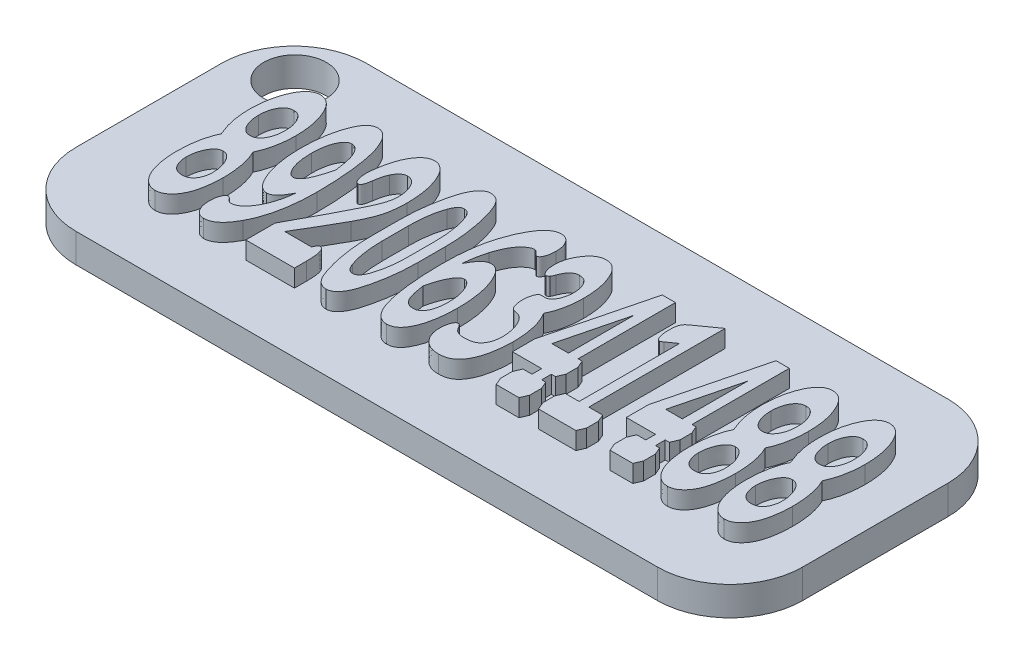
from build123d import *

# Parameters (mm, degrees)
SKETCH_1_W          = 50
SKETCH_1_H          = 20
EXTRUDE_1_DEPTH     = 2
EXTRUDE_448_DEPTH   = 1.2
FILLET_1_R          = 5
FILLET_2_R          = 5
FILLET_3_R          = 5
FILLET_4_R          = 5
SKETCH_4_R          = 2.151855383
CUT_EXTRUDE_1_DEPTH = 3


with BuildPart() as part:
    # Эскиз1 → Бобышка-Вытянуть1 (new body)
    with BuildSketch(Plane(origin=(0, 0, 0), x_dir=(1, 0, 0), z_dir=(0, 1, 0))):
        with Locations((25, 10)):
            Rectangle(SKETCH_1_W, SKETCH_1_H)
    extrude(amount=EXTRUDE_1_DEPTH)

    # Эскиз2 → Extrude 448 (add)
    # profile 1 of 11: a face of its own
    with BuildSketch(Plane(origin=(0, 2, 0), x_dir=(1, 0, 0), z_dir=(0, 1, 0))):
        with BuildLine():
            add(Edge.make_bspline(
                [(7.573556309, 9.600285908), (7.614097975, 9.514557394), (7.696746897, 9.339789807), (7.797801731, 9.062374027), (7.880558655, 8.767248004), (7.951489199, 8.456701902), (8.00595283, 8.129212501), (8.044897616, 7.785319285), (8.06867813, 7.42575086), (8.071567234, 7.180504155), (8.073036116, 7.05581548)],
                knots=[0, 0, 0, 0, 0.869863627, 1.773318598, 2.705048754, 3.681115649, 4.69499462, 5.749702211, 6.855900433, 8, 8, 8, 8], degree=3))
            add(Edge.make_bspline(
                [(8.073036116, 7.05581548), (8.071300059, 6.917145605), (8.067898843, 6.645468945), (8.03317454, 6.246264419), (7.975620786, 5.864714253), (7.898566629, 5.502509161), (7.800399961, 5.166235556), (7.670137386, 4.865473177), (7.520838011, 4.597477557), (7.339918246, 4.372882613), (7.143065075, 4.191376949), (6.932401715, 4.057830032), (6.707417427, 3.977887628), (6.552534727, 3.967409177), (6.47522375, 3.962178772)],
                knots=[0, 0, 0, 0, 1.307194334, 2.561004629, 3.774488178, 4.943198719, 6.050810285, 7.0706307, 8.027859035, 8.934048178, 9.777701725, 10.541735887, 11.272095442, 12, 12, 12, 12], degree=3))
            add(Edge.make_bspline(
                [(6.47522375, 3.962178772), (6.398758529, 3.967377244), (6.245524582, 3.977794821), (6.022692765, 4.058574413), (5.812990911, 4.190715372), (5.618085633, 4.372268194), (5.44331203, 4.599271211), (5.292379621, 4.86580684), (5.163838969, 5.168326766), (5.064629644, 5.505868942), (4.987398844, 5.868910316), (4.934027364, 6.250889169), (4.897970237, 6.648043089), (4.894747173, 6.91800445), (4.89310185, 7.05581548)],
                knots=[0, 0, 0, 0, 0.721796221, 1.446457375, 2.212675403, 3.05265627, 3.951211607, 4.911176021, 5.941488938, 7.052266429, 8.232375546, 9.44812684, 10.697308883, 12, 12, 12, 12], degree=3))
            add(Edge.make_bspline(
                [(4.89310185, 7.05581548), (4.894568323, 7.180504891), (4.897452689, 7.425753043), (4.9212673, 7.78531105), (4.960090766, 8.129241336), (5.014981174, 8.456600333), (5.08446419, 8.767842206), (5.172490412, 9.061301884), (5.268561762, 9.340392082), (5.351724858, 9.514667147), (5.392581656, 9.600285908)],
                knots=[0, 0, 0, 0, 1.144171302, 2.250438881, 3.305212602, 4.319155143, 5.295283236, 6.229301096, 7.130081833, 8, 8, 8, 8], degree=3))
            add(Edge.make_bspline(
                [(5.392581656, 9.600285908), (5.315817568, 9.787048365), (5.160841455, 10.164096025), (5.006931525, 10.766990108), (4.909981225, 11.402377485), (4.898807421, 11.838421115), (4.89310185, 12.061073855)],
                knots=[0, 0, 0, 0, 0.957073933, 1.932200357, 2.944139471, 4, 4, 4, 4], degree=3))
            add(Edge.make_bspline(
                [(4.89310185, 12.061073855), (4.898418341, 12.27754542), (4.908708054, 12.696511582), (4.993522254, 13.301262805), (5.130459125, 13.859724169), (5.292766455, 14.287625184), (5.444959878, 14.59626455), (5.572022432, 14.792435075), (5.701256202, 14.962512673), (5.841669645, 15.100122201), (5.988929324, 15.210766986), (6.147233304, 15.286698295), (6.313045616, 15.333643061), (6.426107165, 15.339862642), (6.483068983, 15.342996144)],
                knots=[0, 0, 0, 0, 1.967284804, 3.807547495, 5.539313067, 7.184775065, 7.957393082, 8.663057112, 9.306676465, 9.895090154, 10.445108397, 10.973224193, 11.482697546, 12, 12, 12, 12], degree=3))
            add(Edge.make_bspline(
                [(6.483068983, 15.342996144), (6.540030622, 15.339862528), (6.653091816, 15.33364272), (6.818906789, 15.286699655), (6.977200186, 15.210761579), (7.124502289, 15.100143922), (7.264739854, 14.962421929), (7.394438864, 14.793194832), (7.518098227, 14.595404626), (7.670991349, 14.28749902), (7.836385865, 13.860286235), (7.972388537, 13.301187823), (8.057492836, 12.696532351), (8.06774106, 12.277552495), (8.073036116, 12.061073855)],
                knots=[0, 0, 0, 0, 0.517362775, 1.026895537, 1.555072916, 2.105155296, 2.693637599, 3.337332004, 4.038837688, 4.811545799, 6.460041003, 8.192008513, 10.032485794, 12, 12, 12, 12], degree=3))
            add(Edge.make_bspline(
                [(8.073036116, 12.061073855), (8.067469393, 11.836644637), (8.056587536, 11.397929314), (7.95824123, 10.760579226), (7.810565083, 10.157347516), (7.651813566, 9.784220506), (7.573556309, 9.600285908)],
                knots=[0, 0, 0, 0, 1.063791813, 2.079505389, 3.053283751, 4, 4, 4, 4], degree=3))
        make_face()
        with BuildLine():
            add(Edge.make_bspline(
                [(7.40357627, 12.000927072), (7.400881187, 12.101399241), (7.3956698, 12.295678693), (7.346723591, 12.574577781), (7.273005759, 12.832078474), (7.163415472, 13.060108044), (7.032907644, 13.254347429), (6.872502773, 13.398604446), (6.686741605, 13.488581823), (6.552877353, 13.497503384), (6.48568406, 13.50198157)],
                knots=[0, 0, 0, 0, 1.239528042, 2.396831194, 3.486589409, 4.536162785, 5.509682768, 6.35620442, 7.174895202, 8, 8, 8, 8], degree=3))
            add(Edge.make_bspline(
                [(6.48568406, 13.50198157), (6.41756145, 13.497655353), (6.282708964, 13.489091368), (6.096066845, 13.397823779), (5.933161756, 13.255405207), (5.802856554, 13.059951899), (5.693093666, 12.832123363), (5.619425513, 12.574564807), (5.570465074, 12.295682293), (5.565255725, 12.101400468), (5.562561695, 12.000927072)],
                knots=[0, 0, 0, 0, 0.833820688, 1.650594315, 2.50321944, 3.474459699, 4.521575254, 5.608781546, 6.763374602, 8, 8, 8, 8], degree=3))
            add(Edge.make_bspline(
                [(5.562561695, 12.000927072), (5.565266502, 11.89959127), (5.570497938, 11.703595072), (5.619342719, 11.422020541), (5.693413454, 11.162223891), (5.80108844, 10.931934152), (5.93514389, 10.738900345), (6.094340772, 10.592500066), (6.283734232, 10.506365477), (6.417745012, 10.495115588), (6.48568406, 10.489412265)],
                knots=[0, 0, 0, 0, 1.241668429, 2.401543046, 3.494043673, 4.546047416, 5.504137523, 6.359918461, 7.168532727, 8, 8, 8, 8], degree=3))
            add(Edge.make_bspline(
                [(6.48568406, 10.489412265), (6.552695802, 10.495261034), (6.685717473, 10.506871134), (6.874233464, 10.591733044), (7.030924822, 10.739942893), (7.165187614, 10.931776637), (7.272684512, 11.162269517), (7.346806805, 11.422007357), (7.395636821, 11.703598728), (7.400870371, 11.899592516), (7.40357627, 12.000927072)],
                knots=[0, 0, 0, 0, 0.822795555, 1.633290479, 2.483061068, 3.443379481, 4.497829953, 5.592871494, 6.755443724, 8, 8, 8, 8], degree=3))
        make_face(mode=Mode.SUBTRACT)
        with BuildLine():
            add(Edge.make_bspline(
                [(7.40357627, 7.032279782), (7.40083224, 7.132728778), (7.395428238, 7.330549733), (7.344625757, 7.619766765), (7.260193419, 7.893490889), (7.148083999, 8.145792408), (7.013914707, 8.362633192), (6.856156217, 8.525506054), (6.676981716, 8.630098946), (6.547067499, 8.642358414), (6.483068983, 8.64839769)],
                knots=[0, 0, 0, 0, 1.189489759, 2.34254209, 3.466495789, 4.576118851, 5.607605723, 6.469471387, 7.246028937, 8, 8, 8, 8], degree=3))
            add(Edge.make_bspline(
                [(6.483068983, 8.64839769), (6.419071355, 8.642357997), (6.289158942, 8.630097682), (6.109970089, 8.525511526), (5.952276444, 8.362608226), (5.817382195, 8.145228937), (5.706032156, 7.890764764), (5.62148475, 7.614512598), (5.570417776, 7.320959943), (5.565221953, 7.119656519), (5.562561695, 7.016589317)],
                knots=[0, 0, 0, 0, 0.748318014, 1.519053169, 2.374456823, 3.398209916, 4.508873786, 5.634203001, 6.788713712, 8, 8, 8, 8], degree=3))
            add(Edge.make_bspline(
                [(5.562561695, 7.016589317), (5.564519013, 6.937906225), (5.568358614, 6.783556341), (5.614649943, 6.561063276), (5.686188734, 6.353459053), (5.781401031, 6.163023537), (5.912177847, 6.003496362), (6.075347034, 5.885390745), (6.270349502, 5.815595323), (6.410142975, 5.807445081), (6.483068983, 5.803193347)],
                knots=[0, 0, 0, 0, 1.103259055, 2.164224919, 3.174489227, 4.181783474, 5.137723691, 6.0412155, 6.978161634, 8, 8, 8, 8], degree=3))
            add(Edge.make_bspline(
                [(6.483068983, 5.803193347), (6.556895147, 5.807344341), (6.697617482, 5.81525668), (6.893245968, 5.885521907), (7.056713141, 6.002687874), (7.184294754, 6.164041181), (7.28132663, 6.35464223), (7.350843043, 6.565721818), (7.39824932, 6.79308981), (7.401765162, 6.950957658), (7.40357627, 7.032279782)],
                knots=[0, 0, 0, 0, 1.024249911, 1.952354446, 2.84732035, 3.786524278, 4.784313077, 5.807988776, 6.870833993, 8, 8, 8, 8], degree=3))
        make_face(mode=Mode.SUBTRACT)
    # profile 2 of 11: a face of its own
    with BuildSketch(Plane(origin=(0, 2, 0), x_dir=(1, 0, 0), z_dir=(0, 1, 0))):
        with BuildLine():
            add(Edge.make_bspline(
                [(11.487281327, 8.64839769), (11.443120138, 8.563194295), (11.360211839, 8.403233281), (11.227347166, 8.189670085), (11.101271099, 8.014308364), (10.981695952, 7.875258561), (10.860868515, 7.771543805), (10.73789485, 7.699387944), (10.611308828, 7.650740653), (10.523600736, 7.646361206), (10.480476482, 7.644207922)],
                knots=[0, 0, 0, 0, 1.544491333, 2.899630935, 4.044871523, 5.019150062, 5.845686048, 6.594201469, 7.308797954, 8, 8, 8, 8], degree=3))
            add(Edge.make_bspline(
                [(10.480476482, 7.644207922), (10.430290606, 7.647817631), (10.329782088, 7.655046887), (10.183984439, 7.712466058), (10.043153577, 7.800943198), (9.907418997, 7.92533019), (9.779803639, 8.086066605), (9.65342786, 8.277990517), (9.534963838, 8.506651707), (9.42092589, 8.765889021), (9.31824374, 9.051066319), (9.226522564, 9.355676466), (9.147531027, 9.677551496), (9.086438701, 10.01754375), (9.035758997, 10.373307064), (9.003124173, 10.746078019), (8.981616037, 11.135084147), (8.978430245, 11.400300708), (8.976806907, 11.535443274)],
                knots=[0, 0, 0, 0, 0.540116355, 1.081704643, 1.668900416, 2.328128021, 3.056702268, 3.878395356, 4.803970782, 5.831493441, 6.932328587, 8.071895476, 9.262630745, 10.505951035, 11.797462611, 13.138567462, 14.541941224, 16, 16, 16, 16], degree=3))
            add(Edge.make_bspline(
                [(8.976806907, 11.535443274), (8.979878585, 11.746549179), (8.985894355, 12.159992454), (9.045914146, 12.764320197), (9.136496445, 13.340136315), (9.231105871, 13.708310595), (9.277540822, 13.889013043)],
                knots=[0, 0, 0, 0, 1.064168464, 2.084135415, 3.059680597, 4, 4, 4, 4], degree=3))
            add(Edge.make_bspline(
                [(9.277540822, 13.889013043), (9.312722205, 14.002800007), (9.379225867, 14.217892454), (9.495353429, 14.516034372), (9.625556706, 14.767410328), (9.763771865, 14.976387376), (9.915484797, 15.139702578), (10.080541985, 15.254844306), (10.256576245, 15.329464525), (10.3795264, 15.338473449), (10.441250319, 15.342996144)],
                knots=[0, 0, 0, 0, 1.436180298, 2.714823602, 3.852703128, 4.844061658, 5.728925662, 6.522115595, 7.258066685, 8, 8, 8, 8], degree=3))
            add(Edge.make_bspline(
                [(10.441250319, 15.342996144), (10.48499613, 15.339980522), (10.572875844, 15.333922523), (10.703346169, 15.300039727), (10.826729708, 15.236568608), (10.949335325, 15.155760012), (11.063874085, 15.046298247), (11.173728678, 14.913745616), (11.28098276, 14.759182636), (11.382705398, 14.580405977), (11.477619014, 14.379480761), (11.571081288, 14.158754904), (11.651873381, 13.915640274), (11.733225342, 13.653416946), (11.797527188, 13.367406965), (11.864523737, 13.062959851), (11.921962435, 12.736666198), (11.986351341, 12.271998383), (12.057994352, 11.670208848), (12.112579501, 10.931994349), (12.152408758, 10.178655307), (12.155287663, 9.670948051), (12.156741173, 9.414615404)],
                knots=[0, 0, 0, 0, 0.402210474, 0.807989175, 1.226820742, 1.670824282, 2.152214144, 2.674888608, 3.249973138, 3.877429647, 4.56122259, 5.289612762, 6.07684574, 6.9125179, 7.809462526, 8.76710454, 9.775136441, 10.85051479, 13.074497134, 15.338564747, 17.646521651, 20, 20, 20, 20], degree=3))
            add(Edge.make_bspline(
                [(12.156741173, 9.414615404), (12.154611607, 9.200102556), (12.15046068, 8.781976483), (12.107252636, 8.171989025), (12.0400466, 7.594116992), (11.946568186, 7.048348086), (11.828035131, 6.533913539), (11.677341373, 6.054064828), (11.505265073, 5.603486626), (11.361652133, 5.323489564), (11.291150513, 5.186035052)],
                knots=[0, 0, 0, 0, 1.180832844, 2.301666342, 3.364825312, 4.382616933, 5.348807173, 6.268666431, 7.150063902, 8, 8, 8, 8], degree=3))
            add(Edge.make_bspline(
                [(11.291150513, 5.186035052), (11.235884251, 5.089309312), (11.130582541, 4.905012684), (10.958139223, 4.654318466), (10.779370561, 4.444113433), (10.599607472, 4.268136364), (10.411664053, 4.132527393), (10.219965318, 4.034140776), (10.023105765, 3.972455853), (9.889884021, 3.965576274), (9.824092024, 3.962178772)],
                knots=[0, 0, 0, 0, 1.334909709, 2.54347351, 3.640443885, 4.638032018, 5.551364312, 6.406426828, 7.213008643, 8, 8, 8, 8], degree=3))
            add(Edge.make_bspline(
                [(9.824092024, 3.962178772), (9.753406595, 3.967465112), (9.615349029, 3.977790002), (9.423069807, 4.06783393), (9.260135852, 4.216415572), (9.18270215, 4.345824267), (9.141556791, 4.414587183)],
                knots=[0, 0, 0, 0, 0.978915843, 1.911946217, 2.890486694, 4, 4, 4, 4], degree=3))
            add(Edge.make_bspline(
                [(9.141556791, 4.414587183), (9.115145115, 4.467877985), (9.060198525, 4.578743643), (9.014743898, 4.768366881), (8.981635621, 4.978252173), (8.978467391, 5.12659397), (8.976806907, 5.204340595)],
                knots=[0, 0, 0, 0, 0.873536651, 1.817297042, 2.856035239, 4, 4, 4, 4], degree=3))
            add(Edge.make_bspline(
                [(8.976806907, 5.204340595), (8.978729981, 5.267999654), (8.982426179, 5.390353994), (8.998760292, 5.565793479), (9.033354377, 5.724389396), (9.079353503, 5.863724378), (9.133354691, 5.981932664), (9.199664895, 6.06619865), (9.269097869, 6.12918679), (9.324484335, 6.135111997), (9.350762992, 6.13792327)],
                knots=[0, 0, 0, 0, 1.419175441, 2.727691474, 3.920195547, 5.025849715, 5.998814525, 6.787596777, 7.424763283, 8, 8, 8, 8], degree=3))
            add(Edge.make_bspline(
                [(9.350762992, 6.13792327), (9.382773052, 6.127965343), (9.463422998, 6.102876158), (9.515491409, 6.035018737), (9.546893807, 5.994094006)],
                knots=[0, 0, 0, 0, 0.793802374, 2, 2, 2, 2], degree=3))
            add(Edge.make_bspline(
                [(9.546893807, 5.994094006), (9.570445248, 5.965433361), (9.614066841, 5.912348585), (9.687655126, 5.848914152), (9.76703836, 5.812349348), (9.821161039, 5.806200307), (9.847627721, 5.803193347)],
                knots=[0, 0, 0, 0, 1.206683572, 2.234999471, 3.136892176, 4, 4, 4, 4], degree=3))
            add(Edge.make_bspline(
                [(9.847627721, 5.803193347), (9.895024222, 5.805572391), (9.989720428, 5.810325621), (10.128519102, 5.853825328), (10.266772506, 5.915780341), (10.398905962, 6.009581437), (10.529753296, 6.126311855), (10.652963112, 6.272450751), (10.780009499, 6.439005536), (10.940586919, 6.702591136), (11.122986817, 7.069602289), (11.295376695, 7.554890094), (11.421772, 8.085457175), (11.464993829, 8.456874799), (11.487281327, 8.64839769)],
                knots=[0, 0, 0, 0, 0.484168293, 0.967347815, 1.478659544, 2.030891222, 2.618845486, 3.27058146, 3.984812665, 4.762718328, 6.427668094, 8.172882214, 10.026532363, 12, 12, 12, 12], degree=3))
        make_face()
        with BuildLine():
            add(Edge.make_bspline(
                [(11.487281327, 11.404689398), (11.47548573, 11.496273531), (11.452760452, 11.672718592), (11.41340804, 11.926438075), (11.372022499, 12.160375645), (11.326387468, 12.37366511), (11.272439781, 12.565796569), (11.220164612, 12.73811608), (11.158413363, 12.888401877), (11.079735552, 13.055990953), (10.970393897, 13.225893267), (10.8255493, 13.381089174), (10.666311975, 13.485428052), (10.549776703, 13.496594222), (10.493551869, 13.50198157)],
                knots=[0, 0, 0, 0, 1.341561386, 2.584638553, 3.72986605, 4.793097259, 5.751690096, 6.62885173, 7.407292807, 8.109698356, 9.318098846, 10.321251498, 11.190053334, 12, 12, 12, 12], degree=3))
            add(Edge.make_bspline(
                [(10.493551869, 13.50198157), (10.435451232, 13.494972666), (10.31510073, 13.480454321), (10.150726883, 13.367165454), (10.007173173, 13.192292277), (9.880718397, 12.957059594), (9.774400208, 12.669553324), (9.701609912, 12.334202888), (9.653881713, 11.956967505), (9.648886848, 11.690769847), (9.646266752, 11.551133739)],
                knots=[0, 0, 0, 0, 0.604297075, 1.251749713, 2.021041256, 2.959625801, 4.029815661, 5.217391592, 6.540360535, 8, 8, 8, 8], degree=3))
            add(Edge.make_bspline(
                [(9.646266752, 11.551133739), (9.648909721, 11.404532897), (9.653959121, 11.124451504), (9.701587485, 10.727252939), (9.774512787, 10.371772355), (9.882102547, 10.06705024), (10.009809031, 9.81850141), (10.146841716, 9.634937696), (10.297793082, 9.510461458), (10.411680806, 9.493248707), (10.464786016, 9.485222497)],
                knots=[0, 0, 0, 0, 1.482531622, 2.83238157, 4.041481393, 5.146072842, 6.092829469, 6.853155664, 7.465232874, 8, 8, 8, 8], degree=3))
            add(Edge.make_bspline(
                [(10.464786016, 9.485222497), (10.5123559, 9.491123235), (10.615011535, 9.503857005), (10.753207026, 9.6101873), (10.88780989, 9.763359278), (11.015431521, 9.978643306), (11.139812025, 10.250918549), (11.2610164, 10.581959775), (11.381437375, 10.971900123), (11.45050874, 11.254328597), (11.487281327, 11.404689398)],
                knots=[0, 0, 0, 0, 0.497696831, 1.074027963, 1.777276761, 2.652500584, 3.697328195, 4.93381738, 6.367609082, 8, 8, 8, 8], degree=3))
        make_face(mode=Mode.SUBTRACT)
    # profile 3 of 11: a face of its own
    with BuildSketch(Plane(origin=(0, 2, 0), x_dir=(1, 0, 0), z_dir=(0, 1, 0))):
        with BuildLine():
            Line((13.395241887, 5.970558308), (15.236256462, 5.970558308))
            add(Edge.make_bspline(
                [(15.236256462, 5.970558308), (15.256515809, 6.020365842), (15.292357716, 6.108483042), (15.357985167, 6.211420135), (15.416245749, 6.287769686), (15.466187484, 6.300082229), (15.487303904, 6.305288231)],
                knots=[0, 0, 0, 0, 1.476957829, 2.612965951, 3.413532736, 4, 4, 4, 4], degree=3))
            add(Edge.make_bspline(
                [(15.487303904, 6.305288231), (15.518828242, 6.301902429), (15.583925969, 6.29491075), (15.668282977, 6.227348066), (15.742609241, 6.130570934), (15.800823411, 5.990750979), (15.851281352, 5.80865021), (15.880979504, 5.574693963), (15.901814361, 5.288420588), (15.904342621, 5.079747466), (15.905716307, 4.96636854)],
                knots=[0, 0, 0, 0, 0.49648233, 1.025235526, 1.659617377, 2.437817421, 3.419908268, 4.671012068, 6.191252082, 8, 8, 8, 8], degree=3))
            Line((15.905716307, 4.96636854), (15.905716307, 4.129543734))
            Line((15.905716307, 4.129543734), (12.55841708, 4.129543734))
            Line((12.55841708, 4.129543734), (12.55841708, 6.13792327))
            add(Edge.make_bspline(
                [(12.55841708, 6.13792327), (12.641397942, 6.289505408), (12.80341799, 6.585469376), (13.037886444, 7.020527309), (13.264145856, 7.432033631), (13.472134694, 7.825888853), (13.671585993, 8.1963858), (13.857265847, 8.546809745), (14.029897402, 8.877616955), (14.192103673, 9.186138894), (14.337684754, 9.476000761), (14.475904435, 9.741625587), (14.594729515, 9.990791725), (14.703631995, 10.217870427), (14.805535581, 10.421570363), (14.88824077, 10.607296972), (14.958900225, 10.772409732), (15.00184386, 10.875541131), (15.021820105, 10.923515134)],
                knots=[0, 0, 0, 0, 1.540533833, 3.007890707, 4.405782956, 5.726830237, 6.978398166, 8.156831539, 9.262153626, 10.304869543, 11.264060161, 12.153748005, 12.973970219, 13.724693827, 14.398925648, 15.004106032, 15.536736427, 16, 16, 16, 16], degree=3))
            add(Edge.make_bspline(
                [(15.021820105, 10.923515134), (15.054725346, 11.012803483), (15.118791104, 11.186645874), (15.187113675, 11.449056476), (15.228311427, 11.704973621), (15.233635861, 11.873516607), (15.236256462, 11.956470755)],
                knots=[0, 0, 0, 0, 1.07571973, 2.094401928, 3.062095275, 4, 4, 4, 4], degree=3))
            add(Edge.make_bspline(
                [(15.236256462, 11.956470755), (15.233344945, 12.055160121), (15.227641701, 12.248478463), (15.180130156, 12.52883871), (15.100911714, 12.791628836), (14.993919429, 13.02943843), (14.86577862, 13.236699105), (14.705604701, 13.387708744), (14.522676472, 13.486950637), (14.390150942, 13.496956472), (14.323594407, 13.50198157)],
                knots=[0, 0, 0, 0, 1.201656711, 2.353873494, 3.452380439, 4.536004299, 5.525640415, 6.397189124, 7.195041602, 8, 8, 8, 8], degree=3))
            add(Edge.make_bspline(
                [(14.323594407, 13.50198157), (14.254831396, 13.494914998), (14.115548402, 13.480601296), (13.926348402, 13.3573784), (13.755376411, 13.174753228), (13.672836974, 13.015707477), (13.627983786, 12.929279592)],
                knots=[0, 0, 0, 0, 0.862288605, 1.746609652, 2.775473348, 4, 4, 4, 4], degree=3))
            add(Edge.make_bspline(
                [(13.627983786, 12.929279592), (13.602992354, 12.873141503), (13.548444733, 12.750611543), (13.493761476, 12.53994957), (13.436507375, 12.295491383), (13.409616198, 12.11887216), (13.395241887, 12.02446277)],
                knots=[0, 0, 0, 0, 0.785419257, 1.714297573, 2.77820903, 4, 4, 4, 4], degree=3))
            add(Edge.make_bspline(
                [(13.395241887, 12.02446277), (13.387069001, 11.965968447), (13.372010777, 11.858194933), (13.34336405, 11.70960157), (13.311610243, 11.587103538), (13.271679086, 11.490968288), (13.230276401, 11.417229793), (13.182753184, 11.364769515), (13.127376187, 11.332889361), (13.087894837, 11.328439245), (13.068357197, 11.326237072)],
                knots=[0, 0, 0, 0, 1.718687884, 3.166615548, 4.403826944, 5.393296858, 6.189559062, 6.853582291, 7.432686669, 8, 8, 8, 8], degree=3))
            add(Edge.make_bspline(
                [(13.068357197, 11.326237072), (13.044713676, 11.329293628), (12.99338818, 11.33592882), (12.930412657, 11.398712594), (12.869384978, 11.482858918), (12.801202791, 11.648894906), (12.739845015, 11.898293317), (12.730632698, 12.111137563), (12.725782041, 12.223208662)],
                knots=[0, 0, 0, 0, 0.410077716, 0.890199137, 1.495835442, 2.252637047, 4.026861929, 6, 6, 6, 6], degree=3))
            add(Edge.make_bspline(
                [(12.725782041, 12.223208662), (12.728815601, 12.318313789), (12.735290836, 12.521318865), (12.77422712, 12.840865069), (12.835261829, 13.194319076), (12.918971663, 13.569169767), (13.022294715, 13.943533333), (13.155847877, 14.288980572), (13.312290667, 14.593551393), (13.488026402, 14.856726328), (13.681893014, 15.068162975), (13.885222111, 15.227451668), (14.104068998, 15.32292409), (14.254776852, 15.336383229), (14.328824562, 15.342996144)],
                knots=[0, 0, 0, 0, 0.906154377, 1.934216822, 3.063307913, 4.32257274, 5.592200714, 6.759641067, 7.844211716, 8.848486001, 9.765233724, 10.565799872, 11.295330456, 12, 12, 12, 12], degree=3))
            add(Edge.make_bspline(
                [(14.328824562, 15.342996144), (14.385771424, 15.339953901), (14.499040263, 15.333902796), (14.664553054, 15.285665935), (14.817813019, 15.200380847), (14.967071375, 15.089971532), (15.104667497, 14.943082526), (15.236981767, 14.766816905), (15.354254053, 14.555247478), (15.511374069, 14.23283751), (15.670655024, 13.778714607), (15.809539407, 13.186274379), (15.889240053, 12.53916926), (15.900088879, 12.090057806), (15.905716307, 11.857097809)],
                knots=[0, 0, 0, 0, 0.494761144, 0.984093207, 1.482556146, 2.013120243, 2.59204621, 3.225693145, 3.925144707, 4.691273024, 6.343201327, 8.095260062, 9.974560224, 12, 12, 12, 12], degree=3))
            add(Edge.make_bspline(
                [(15.905716307, 11.857097809), (15.904753709, 11.736733462), (15.902860443, 11.499997211), (15.87176809, 11.151877055), (15.828355736, 10.816505679), (15.765399682, 10.483248666), (15.663545782, 10.133051495), (15.514455541, 9.745534622), (15.314670037, 9.309693271), (15.155872151, 9.007625217), (15.071506578, 8.847143582)],
                knots=[0, 0, 0, 0, 0.912749152, 1.795222735, 2.649062997, 3.477746559, 4.365161243, 5.411535187, 6.624809669, 8, 8, 8, 8], degree=3))
            add(Edge.make_bspline(
                [(15.071506578, 8.847143582), (15.031581512, 8.773825367), (14.94387655, 8.612764363), (14.79702994, 8.352837412), (14.628845761, 8.050926867), (14.426443944, 7.714093246), (14.206982633, 7.333265212), (13.960677941, 6.913219275), (13.684569595, 6.456656537), (13.494411642, 6.137172984), (13.395241887, 5.970558308)],
                knots=[0, 0, 0, 0, 0.601747611, 1.321882616, 2.151886391, 3.092629613, 4.154122148, 5.320095706, 6.602396334, 8, 8, 8, 8], degree=3))
        make_face()
    # profile 4 of 11: a face of its own
    with BuildSketch(Plane(origin=(0, 2, 0), x_dir=(1, 0, 0), z_dir=(0, 1, 0))):
        with BuildLine():
            Line((19.822056403, 10.596630443), (19.822056403, 8.708544473))
            add(Edge.make_bspline(
                [(19.822056403, 8.708544473), (19.816904474, 8.432046079), (19.806694901, 7.884109393), (19.728905569, 7.070741409), (19.601642054, 6.274674293), (19.451951183, 5.63174011), (19.313920316, 5.148200517), (19.193082113, 4.835397678), (19.06453519, 4.569216662), (18.923019986, 4.351387393), (18.770942105, 4.178403035), (18.603583293, 4.055362338), (18.423626723, 3.975058565), (18.297372791, 3.966451197), (18.234704347, 3.962178772)],
                knots=[0, 0, 0, 0, 1.872673122, 3.711075104, 5.529225634, 7.329580626, 8.179610133, 8.932920447, 9.598355524, 10.178084822, 10.688068346, 11.148661017, 11.577422355, 12, 12, 12, 12], degree=3))
            add(Edge.make_bspline(
                [(18.234704347, 3.962178772), (18.163098049, 3.967442375), (18.020515124, 3.977923294), (17.820093188, 4.072884992), (17.637367438, 4.219142558), (17.507076275, 4.38689956), (17.407594793, 4.550345663), (17.336287846, 4.703103417), (17.263184898, 4.8785026), (17.189774986, 5.077118893), (17.120233422, 5.300186804), (17.049784906, 5.546112318), (16.978525016, 5.816051721), (16.888149788, 6.211811939), (16.790591085, 6.731524411), (16.702797356, 7.374529202), (16.653931287, 8.035706193), (16.646085967, 8.482701241), (16.642122137, 8.708544473)],
                knots=[0, 0, 0, 0, 0.642640119, 1.279629165, 1.962282587, 2.739474992, 3.180359586, 3.686689951, 4.257568184, 4.894314614, 5.595458888, 6.364336271, 7.20144684, 8.113027288, 10.024980623, 11.968482452, 13.963084925, 16, 16, 16, 16], degree=3))
            Line((16.642122137, 8.708544473), (16.642122137, 10.596630443))
            add(Edge.make_bspline(
                [(16.642122137, 10.596630443), (16.647338081, 10.872247431), (16.657690701, 11.419292825), (16.734721099, 12.231062213), (16.863933224, 13.025621842), (17.008956643, 13.668610802), (17.148378288, 14.152323265), (17.267667611, 14.466661007), (17.397983894, 14.733575723), (17.537583905, 14.953623625), (17.690580889, 15.125714473), (17.855665239, 15.250569948), (18.035405995, 15.33000468), (18.161603568, 15.338686677), (18.224244037, 15.342996144)],
                knots=[0, 0, 0, 0, 1.867917534, 3.707448116, 5.520882168, 7.321014604, 8.171565946, 8.930852488, 9.596696077, 10.181724631, 10.692021235, 11.148138377, 11.577162933, 12, 12, 12, 12], degree=3))
            add(Edge.make_bspline(
                [(18.224244037, 15.342996144), (18.295746132, 15.337496131), (18.437769836, 15.326571524), (18.639489124, 15.235531296), (18.820614653, 15.089256697), (18.950019221, 14.92253741), (19.048035427, 14.760581854), (19.120812757, 14.609421336), (19.192614477, 14.435164619), (19.266488855, 14.237379138), (19.339961835, 14.015236274), (19.408397177, 13.767554168), (19.480637049, 13.497027445), (19.570413226, 13.100952784), (19.671369331, 12.580785778), (19.761829259, 11.936910266), (19.810250111, 11.272945392), (19.818083533, 10.824213436), (19.822056403, 10.596630443)],
                knots=[0, 0, 0, 0, 0.642344401, 1.275880528, 1.958219819, 2.724006707, 3.164688423, 3.663720908, 4.234336445, 4.863422188, 5.566662655, 6.342741925, 7.179467287, 8.090628261, 10.003171379, 11.954627198, 13.948311832, 16, 16, 16, 16], degree=3))
        make_face()
        with BuildLine():
            add(Edge.make_bspline(
                [(19.152596557, 10.567864591), (19.149452051, 10.786899025), (19.143347024, 11.21215213), (19.071347173, 11.827950094), (18.968737394, 12.404280746), (18.853119647, 12.764651455), (18.796946015, 12.939739902)],
                knots=[0, 0, 0, 0, 1.090347458, 2.116898395, 3.085082863, 4, 4, 4, 4], degree=3))
            add(Edge.make_bspline(
                [(18.796946015, 12.939739902), (18.764271985, 13.023863674), (18.704875713, 13.176787521), (18.569094972, 13.357869641), (18.411050807, 13.483026909), (18.288892639, 13.495778918), (18.229474192, 13.50198157)],
                knots=[0, 0, 0, 0, 1.26538402, 2.300270066, 3.173241431, 4, 4, 4, 4], degree=3))
            add(Edge.make_bspline(
                [(18.229474192, 13.50198157), (18.200441655, 13.499864576), (18.142680317, 13.495652737), (18.059205196, 13.464342385), (17.978907912, 13.416288135), (17.903751318, 13.347044327), (17.83196916, 13.259296728), (17.768317154, 13.150454413), (17.704645893, 13.025296375), (17.669816229, 12.933163083), (17.65154206, 12.884823275)],
                knots=[0, 0, 0, 0, 0.773889233, 1.539682063, 2.354176973, 3.26093301, 4.253579485, 5.371542193, 6.620920351, 8, 8, 8, 8], degree=3))
            add(Edge.make_bspline(
                [(17.65154206, 12.884823275), (17.598097171, 12.72017243), (17.487055603, 12.378080081), (17.389224663, 11.821760087), (17.321222641, 11.21376433), (17.314877064, 10.788626753), (17.311581982, 10.567864591)],
                knots=[0, 0, 0, 0, 0.882012772, 1.832543419, 2.87449986, 4, 4, 4, 4], degree=3))
            Line((17.311581982, 10.567864591), (17.311581982, 8.737310326))
            add(Edge.make_bspline(
                [(17.311581982, 8.737310326), (17.31627713, 8.517469453), (17.325391106, 8.090725823), (17.390416227, 7.473127309), (17.499058516, 6.898580876), (17.614021161, 6.539706316), (17.669847603, 6.365435014)],
                knots=[0, 0, 0, 0, 1.09463067, 2.124839939, 3.089412786, 4, 4, 4, 4], degree=3))
            add(Edge.make_bspline(
                [(17.669847603, 6.365435014), (17.702803103, 6.28155244), (17.762518381, 6.12955744), (17.895106153, 5.945541569), (18.05544043, 5.82278276), (18.178038184, 5.809578277), (18.237319425, 5.803193347)],
                knots=[0, 0, 0, 0, 1.264540884, 2.291344674, 3.173792307, 4, 4, 4, 4], degree=3))
            add(Edge.make_bspline(
                [(18.237319425, 5.803193347), (18.266360037, 5.805301413), (18.324137438, 5.809495491), (18.407490521, 5.840940778), (18.487739272, 5.888102432), (18.560371322, 5.959142134), (18.632357475, 6.045715331), (18.695814625, 6.154771925), (18.759546358, 6.279863464), (18.794367029, 6.372006645), (18.81263648, 6.420351642)],
                knots=[0, 0, 0, 0, 0.775556524, 1.542999202, 2.359248885, 3.250723015, 4.245508079, 5.365879361, 6.617949219, 8, 8, 8, 8], degree=3))
            add(Edge.make_bspline(
                [(18.81263648, 6.420351642), (18.865812661, 6.585049981), (18.976609828, 6.928213197), (19.078833417, 7.483838031), (19.14190737, 8.092501584), (19.148937667, 8.516593437), (19.152596557, 8.737310326)],
                knots=[0, 0, 0, 0, 0.881942544, 1.837603474, 2.874589474, 4, 4, 4, 4], degree=3))
            Line((19.152596557, 8.737310326), (19.152596557, 10.567864591))
        make_face(mode=Mode.SUBTRACT)
    # profile 5 of 11: a face of its own
    with BuildSketch(Plane(origin=(0, 2, 0), x_dir=(1, 0, 0), z_dir=(0, 1, 0))):
        with BuildLine():
            add(Edge.make_bspline(
                [(21.39528704, 10.154682342), (21.438759985, 10.236309077), (21.520899692, 10.390538243), (21.651308856, 10.599142419), (21.776567179, 10.774997377), (21.901818696, 10.915862086), (22.02973155, 11.023233338), (22.159187074, 11.102280888), (22.295292926, 11.148827271), (22.387823808, 11.155553705), (22.433472816, 11.158872111)],
                knots=[0, 0, 0, 0, 1.465394451, 2.768781149, 3.896278152, 4.884185413, 5.747428652, 6.53408452, 7.276808084, 8, 8, 8, 8], degree=3))
            add(Edge.make_bspline(
                [(22.433472816, 11.158872111), (22.48192536, 11.156194171), (22.580808278, 11.150728978), (22.723354955, 11.093174475), (22.862931502, 11.008460521), (22.992552472, 10.884689411), (23.118766646, 10.730482026), (23.242143762, 10.543329261), (23.357664626, 10.32065526), (23.468887203, 10.068054689), (23.573391104, 9.791114729), (23.660818043, 9.492531935), (23.736523816, 9.178327445), (23.80036989, 8.846957387), (23.845711967, 8.49749985), (23.879655275, 8.13114278), (23.9009422, 7.748187147), (23.904130851, 7.487330812), (23.90576146, 7.353934317)],
                knots=[0, 0, 0, 0, 0.531794611, 1.085297036, 1.672178265, 2.32522636, 3.048874063, 3.867303555, 4.79175293, 5.811618404, 6.909614719, 8.053075246, 9.239715287, 10.472597587, 11.772169638, 13.123634062, 14.529086385, 16, 16, 16, 16], degree=3))
            add(Edge.make_bspline(
                [(23.90576146, 7.353934317), (23.905283401, 7.230117559), (23.904350097, 6.988392876), (23.881862594, 6.636056542), (23.850387075, 6.302077547), (23.810903025, 5.98553922), (23.75174393, 5.687608614), (23.685150763, 5.406833225), (23.604047432, 5.144697365), (23.51087966, 4.902471097), (23.407129539, 4.683773502), (23.296338521, 4.490774213), (23.172319945, 4.329776272), (23.040163616, 4.196301653), (22.899281485, 4.090176389), (22.747089537, 4.014457851), (22.584763253, 3.972376849), (22.473796198, 3.965599723), (22.41778235, 3.962178772)],
                knots=[0, 0, 0, 0, 1.474479737, 2.878593745, 4.203060936, 5.470294891, 6.675753598, 7.819022172, 8.906029523, 9.941433398, 10.907408686, 11.787057091, 12.586587044, 13.320749877, 14.018474997, 14.677833336, 15.332597931, 16, 16, 16, 16], degree=3))
            add(Edge.make_bspline(
                [(22.41778235, 3.962178772), (22.370588063, 3.964367074), (22.277920996, 3.968663854), (22.14237133, 3.997357499), (22.014998676, 4.049682425), (21.891133959, 4.116524435), (21.776166676, 4.20721522), (21.667395, 4.316133932), (21.566495422, 4.445303169), (21.468423236, 4.592078149), (21.380392234, 4.762461045), (21.29451202, 4.951391846), (21.215194806, 5.162624247), (21.14734194, 5.395269958), (21.077740317, 5.647514635), (21.015362158, 5.921399382), (20.961468666, 6.217427078), (20.894111472, 6.645678254), (20.828624024, 7.213322189), (20.766872412, 7.924791348), (20.734479193, 8.673377179), (20.72875592, 9.184462573), (20.725827194, 9.445996334)],
                knots=[0, 0, 0, 0, 0.460879461, 0.904947414, 1.344341268, 1.801511854, 2.274799441, 2.768318837, 3.301358059, 3.87264299, 4.489476175, 5.171351898, 5.898573551, 6.690187476, 7.536727362, 8.453481935, 9.431747531, 10.474256865, 12.686015176, 15.009401326, 17.446199683, 20, 20, 20, 20], degree=3))
            add(Edge.make_bspline(
                [(20.725827194, 9.445996334), (20.726505682, 9.603796197), (20.727829415, 9.911664493), (20.747627484, 10.36329967), (20.77492528, 10.795126474), (20.817014544, 11.206709153), (20.869452513, 11.598278634), (20.931108212, 11.96937017), (21.006319151, 12.320401054), (21.123913088, 12.749712011), (21.283036827, 13.240807235), (21.492635381, 13.775584755), (21.722431211, 14.236334013), (21.927964657, 14.573153617), (22.104385439, 14.798674003), (22.232257544, 14.945182683), (22.365054724, 15.067361224), (22.498587052, 15.168223314), (22.633954284, 15.245746526), (22.771105262, 15.301008711), (22.911002209, 15.337624355), (23.005954706, 15.3412102), (23.053246188, 15.342996144)],
                knots=[0, 0, 0, 0, 1.401999204, 2.735307224, 4.016131604, 5.246160239, 6.4105718, 7.526013964, 8.587922108, 9.598746015, 11.479868845, 13.172725954, 14.696815047, 16.050662122, 16.668838488, 17.239373861, 17.776548151, 18.269156699, 18.723566944, 19.157930126, 19.580603633, 20, 20, 20, 20], degree=3))
            add(Edge.make_bspline(
                [(23.053246188, 15.342996144), (23.123962979, 15.337677985), (23.262879216, 15.32723098), (23.456021418, 15.236554604), (23.625101324, 15.093144474), (23.704378845, 14.964008682), (23.746241731, 14.895817888)],
                knots=[0, 0, 0, 0, 0.97450896, 1.914327784, 2.898650478, 4, 4, 4, 4], degree=3))
            add(Edge.make_bspline(
                [(23.746241731, 14.895817888), (23.771479578, 14.843299986), (23.823793897, 14.734438152), (23.871252561, 14.55114137), (23.899832619, 14.348452902), (23.903726902, 14.206419994), (23.90576146, 14.132215252)],
                knots=[0, 0, 0, 0, 0.886041043, 1.836631874, 2.869753664, 4, 4, 4, 4], degree=3))
            add(Edge.make_bspline(
                [(23.90576146, 14.132215252), (23.90375828, 14.066833437), (23.899904195, 13.941039918), (23.884495878, 13.759109262), (23.845984748, 13.595228818), (23.801626084, 13.449677887), (23.745593311, 13.330201333), (23.68385802, 13.239740069), (23.611435061, 13.180543018), (23.556971261, 13.171452205), (23.531805374, 13.167251647)],
                knots=[0, 0, 0, 0, 1.422837942, 2.737516424, 3.960877108, 5.075903291, 6.042474134, 6.815963123, 7.45289647, 8, 8, 8, 8], degree=3))
            add(Edge.make_bspline(
                [(23.531805374, 13.167251647), (23.514788807, 13.170525066), (23.474710004, 13.178234889), (23.416355697, 13.224476809), (23.350227367, 13.29253736), (23.303909008, 13.348141335), (23.278142855, 13.379072926)],
                knots=[0, 0, 0, 0, 0.60853952, 1.433281787, 2.572176248, 4, 4, 4, 4], degree=3))
            add(Edge.make_bspline(
                [(23.278142855, 13.379072926), (23.248716927, 13.414301132), (23.197366664, 13.475776767), (23.120192301, 13.494140887), (23.087242196, 13.50198157)],
                knots=[0, 0, 0, 0, 1.146086751, 2, 2, 2, 2], degree=3))
            add(Edge.make_bspline(
                [(23.087242196, 13.50198157), (23.026157981, 13.496917383), (22.897640574, 13.486262648), (22.711296688, 13.391280426), (22.521588156, 13.253342876), (22.330518756, 13.059463115), (22.145951727, 12.80971021), (21.973360969, 12.500750853), (21.812226329, 12.13566873), (21.724126717, 11.867576322), (21.677715412, 11.726343933)],
                knots=[0, 0, 0, 0, 0.609996292, 1.283394428, 2.060442408, 2.963680496, 4.001327631, 5.168999259, 6.508614997, 8, 8, 8, 8], degree=3))
            add(Edge.make_bspline(
                [(21.677715412, 11.726343933), (21.646962428, 11.615050526), (21.582508436, 11.381794972), (21.504107294, 11.008361413), (21.443282771, 10.595011315), (21.411737121, 10.305600921), (21.39528704, 10.154682342)],
                knots=[0, 0, 0, 0, 0.86626655, 1.815574621, 2.860889655, 4, 4, 4, 4], degree=3))
        make_face()
        with BuildLine():
            add(Edge.make_bspline(
                [(21.39528704, 7.468997728), (21.416756099, 7.321322749), (21.456240388, 7.049729973), (21.539108166, 6.682439433), (21.630135559, 6.389453466), (21.73376321, 6.163794331), (21.86191938, 5.99910843), (22.013657838, 5.885596425), (22.189338797, 5.812473582), (22.315934598, 5.806349286), (22.381171265, 5.803193347)],
                knots=[0, 0, 0, 0, 1.684994445, 3.098915748, 4.247808544, 5.146074259, 5.888742617, 6.577929222, 7.267186148, 8, 8, 8, 8], degree=3))
            add(Edge.make_bspline(
                [(22.381171265, 5.803193347), (22.446700148, 5.807578839), (22.575424748, 5.816193677), (22.752114807, 5.905023451), (22.904150082, 6.041610574), (23.025133597, 6.232503429), (23.118988242, 6.466176554), (23.189091423, 6.737734156), (23.230466084, 7.046703596), (23.234285171, 7.264886507), (23.236301615, 7.380085092)],
                knots=[0, 0, 0, 0, 0.78607407, 1.544159838, 2.334451828, 3.230788347, 4.245423593, 5.366332485, 6.6094476, 8, 8, 8, 8], degree=3))
            add(Edge.make_bspline(
                [(23.236301615, 7.380085092), (23.233528134, 7.513599683), (23.228215867, 7.769330712), (23.181552282, 8.135894838), (23.101769305, 8.467193245), (22.990894148, 8.756162318), (22.864695127, 8.996141712), (22.727084316, 9.17394892), (22.576540582, 9.295636926), (22.463010866, 9.310778865), (22.409937118, 9.317857536)],
                knots=[0, 0, 0, 0, 1.42171169, 2.723116575, 3.927927152, 5.041867869, 6.014102148, 6.800051415, 7.439038768, 8, 8, 8, 8], degree=3))
            add(Edge.make_bspline(
                [(22.409937118, 9.317857536), (22.36598479, 9.31048283), (22.268142178, 9.294065942), (22.133164087, 9.18819781), (21.994605417, 9.033789884), (21.857456927, 8.818561166), (21.722330643, 8.551779989), (21.598561938, 8.234466578), (21.485827209, 7.869153977), (21.426557933, 7.607204265), (21.39528704, 7.468997728)],
                knots=[0, 0, 0, 0, 0.479474003, 1.067360729, 1.814100547, 2.747268226, 3.835419782, 5.072625612, 6.455496393, 8, 8, 8, 8], degree=3))
        make_face(mode=Mode.SUBTRACT)
    # profile 6 of 11: a face of its own
    with BuildSketch(Plane(origin=(0, 2, 0), x_dir=(1, 0, 0), z_dir=(0, 1, 0))):
        with BuildLine():
            add(Edge.make_bspline(
                [(27.176177408, 10.000392769), (27.228533004, 9.910664474), (27.33481565, 9.72851469), (27.463204204, 9.432795887), (27.577645213, 9.119262481), (27.664112298, 8.783202568), (27.735233858, 8.427968852), (27.787927736, 8.052642413), (27.815548043, 7.655961349), (27.819881457, 7.385353993), (27.822101556, 7.246716139)],
                knots=[0, 0, 0, 0, 0.869870093, 1.765849331, 2.697020677, 3.664476357, 4.670172355, 5.732180101, 6.838148042, 8, 8, 8, 8], degree=3))
            add(Edge.make_bspline(
                [(27.822101556, 7.246716139), (27.819687208, 7.095824989), (27.814947736, 6.799618892), (27.774840302, 6.364592495), (27.709839511, 5.94691275), (27.619686951, 5.551787207), (27.50894226, 5.186478734), (27.366926054, 4.866054645), (27.206006736, 4.588711235), (27.01654105, 4.360855198), (26.800083895, 4.177874768), (26.549474562, 4.051412943), (26.267736244, 3.976847623), (26.070466751, 3.967193039), (25.968011593, 3.962178772)],
                knots=[0, 0, 0, 0, 1.291726547, 2.535717178, 3.736994706, 4.908409329, 6.003690681, 6.999447235, 7.903117844, 8.7402297, 9.524786357, 10.312531561, 11.123585492, 12, 12, 12, 12], degree=3))
            add(Edge.make_bspline(
                [(25.968011593, 3.962178772), (25.899877373, 3.963991668), (25.768066169, 3.967498863), (25.576766923, 4.000261657), (25.398749249, 4.05125873), (25.233699629, 4.126188617), (25.082210228, 4.220888972), (24.940789294, 4.333435766), (24.81740252, 4.472341834), (24.746518561, 4.575902881), (24.710159305, 4.62902354)],
                knots=[0, 0, 0, 0, 1.095350794, 2.119045408, 3.113106614, 4.067187038, 5.024560244, 5.981727982, 6.964746484, 8, 8, 8, 8], degree=3))
            add(Edge.make_bspline(
                [(24.710159305, 4.62902354), (24.674076394, 4.694318602), (24.601392603, 4.825846033), (24.528945751, 5.045170288), (24.483804341, 5.280922234), (24.477851564, 5.444711319), (24.474802329, 5.528610207)],
                knots=[0, 0, 0, 0, 0.949534308, 1.912699146, 2.930806525, 4, 4, 4, 4], degree=3))
            add(Edge.make_bspline(
                [(24.474802329, 5.528610207), (24.476741956, 5.592258156), (24.480469969, 5.714591141), (24.496664227, 5.891027503), (24.532450977, 6.0504922), (24.57343872, 6.194223334), (24.630509266, 6.311125519), (24.687801179, 6.402811511), (24.759333665, 6.458883064), (24.811479825, 6.46828798), (24.835683027, 6.472653193)],
                knots=[0, 0, 0, 0, 1.419798329, 2.72888868, 3.94091535, 5.059615324, 6.05050214, 6.832177882, 7.457965195, 8, 8, 8, 8], degree=3))
            add(Edge.make_bspline(
                [(24.835683027, 6.472653193), (24.853516311, 6.470384567), (24.892944417, 6.4653688), (24.948649148, 6.427404293), (25.00017957, 6.366897443), (25.032359325, 6.318772871), (25.050119383, 6.292212844)],
                knots=[0, 0, 0, 0, 0.732052007, 1.618514138, 2.685654147, 4, 4, 4, 4], degree=3))
            add(Edge.make_bspline(
                [(25.050119383, 6.292212844), (25.075570035, 6.249906964), (25.122872757, 6.171277022), (25.198712333, 6.068669649), (25.27163877, 5.987663071), (25.324137146, 5.947263703), (25.348238221, 5.928717068)],
                knots=[0, 0, 0, 0, 1.250437822, 2.32407068, 3.230610512, 4, 4, 4, 4], degree=3))
            add(Edge.make_bspline(
                [(25.348238221, 5.928717068), (25.386916329, 5.909033315), (25.468496333, 5.867516274), (25.608883121, 5.830998988), (25.767533188, 5.806837818), (25.879857521, 5.804453818), (25.93924574, 5.803193347)],
                knots=[0, 0, 0, 0, 0.850766919, 1.794440608, 2.833874725, 4, 4, 4, 4], degree=3))
            add(Edge.make_bspline(
                [(25.93924574, 5.803193347), (26.039154516, 5.806952278), (26.227031493, 5.814020893), (26.486578508, 5.885846355), (26.706075195, 6.001196347), (26.874465688, 6.17396358), (27.001015055, 6.387320301), (27.091657762, 6.637392986), (27.143063283, 6.926478153), (27.149320904, 7.130565468), (27.15264171, 7.238870906)],
                knots=[0, 0, 0, 0, 1.111380136, 2.089933945, 2.977268555, 3.84316133, 4.741550694, 5.725494965, 6.792961411, 8, 8, 8, 8], degree=3))
            add(Edge.make_bspline(
                [(27.15264171, 7.238870906), (27.150691849, 7.322662836), (27.146798792, 7.489960303), (27.113618924, 7.737232008), (27.065168348, 7.981093706), (26.991742402, 8.214917858), (26.904325006, 8.435708246), (26.804376743, 8.634279234), (26.688151652, 8.80673854), (26.59616021, 8.902366781), (26.55117388, 8.949131605)],
                knots=[0, 0, 0, 0, 1.082694984, 2.161689439, 3.220249694, 4.293107415, 5.324695095, 6.287260835, 7.162423724, 8, 8, 8, 8], degree=3))
            add(Edge.make_bspline(
                [(26.55117388, 8.949131605), (26.521365773, 8.972032403), (26.456220214, 9.02208205), (26.33421499, 9.077518957), (26.185370848, 9.121608213), (26.07637635, 9.140384286), (26.017698066, 9.150492574)],
                knots=[0, 0, 0, 0, 0.779284847, 1.70312544, 2.763454478, 4, 4, 4, 4], degree=3))
            add(Edge.make_bspline(
                [(26.017698066, 9.150492574), (25.988775484, 9.157061242), (25.929133445, 9.170606668), (25.855285254, 9.235611015), (25.788021167, 9.320181122), (25.738569537, 9.435389333), (25.698122268, 9.569771489), (25.666852027, 9.721158069), (25.648445694, 9.887483857), (25.647072767, 10.002957877), (25.646357058, 10.063154629)],
                knots=[0, 0, 0, 0, 0.665171661, 1.371668477, 2.177345374, 3.118249364, 4.19768422, 5.372799233, 6.630436936, 8, 8, 8, 8], degree=3))
            add(Edge.make_bspline(
                [(25.646357058, 10.063154629), (25.648284148, 10.125937905), (25.651986104, 10.246545133), (25.668324209, 10.420297084), (25.703594938, 10.577458844), (25.746139332, 10.717263474), (25.798078749, 10.834827889), (25.861423168, 10.921534678), (25.933110316, 10.982170602), (25.988932165, 10.988528615), (26.015082989, 10.991507149)],
                knots=[0, 0, 0, 0, 1.40846337, 2.705670573, 3.90558276, 5.012080196, 5.982663758, 6.764465055, 7.421189778, 8, 8, 8, 8], degree=3))
            add(Edge.make_bspline(
                [(26.015082989, 10.991507149), (26.067390614, 10.99114721), (26.158938644, 10.990517249), (26.274841742, 10.99390936), (26.349887317, 10.995420091), (26.385556649, 10.998404584), (26.396884307, 10.999352382)],
                knots=[0, 0, 0, 0, 1.643077482, 2.87568983, 3.642948177, 4, 4, 4, 4], degree=3))
            add(Edge.make_bspline(
                [(26.396884307, 10.999352382), (26.444901927, 11.018282233), (26.55318926, 11.060972042), (26.689371139, 11.20697992), (26.818136199, 11.407358506), (26.905724088, 11.671089797), (26.974408052, 11.963514445), (26.981647868, 12.169597969), (26.985276749, 12.272895135)],
                knots=[0, 0, 0, 0, 0.620172094, 1.398586218, 2.364491577, 3.50284929, 4.748329874, 6, 6, 6, 6], degree=3))
            add(Edge.make_bspline(
                [(26.985276749, 12.272895135), (26.982888338, 12.353251367), (26.978236914, 12.509744865), (26.938670402, 12.735836001), (26.87261072, 12.945105178), (26.783782482, 13.1349475), (26.668037167, 13.297770549), (26.519202565, 13.418994055), (26.339742557, 13.489014657), (26.211811738, 13.497569681), (26.145836865, 13.50198157)],
                knots=[0, 0, 0, 0, 1.159006793, 2.257161925, 3.299502429, 4.317884941, 5.271428475, 6.157446033, 7.049781245, 8, 8, 8, 8], degree=3))
            add(Edge.make_bspline(
                [(26.145836865, 13.50198157), (26.101975615, 13.499382299), (26.01530805, 13.494246274), (25.890163809, 13.455632857), (25.772330929, 13.39469764), (25.664788568, 13.305974186), (25.565130997, 13.19449631), (25.472510555, 13.059774353), (25.393043814, 12.898203776), (25.346529275, 12.781432683), (25.322087445, 12.720073391)],
                knots=[0, 0, 0, 0, 0.865886865, 1.710947752, 2.566485, 3.473407852, 4.449402959, 5.51526978, 6.694357633, 8, 8, 8, 8], degree=3))
            add(Edge.make_bspline(
                [(25.322087445, 12.720073391), (25.307834122, 12.686214116), (25.28190215, 12.624611794), (25.250864616, 12.539244846), (25.216521071, 12.477619552), (25.194928784, 12.443674198), (25.186103414, 12.429799786)],
                knots=[0, 0, 0, 0, 1.37247341, 2.497027754, 3.385693339, 4, 4, 4, 4], degree=3))
            add(Edge.make_bspline(
                [(25.186103414, 12.429799786), (25.161215695, 12.401543946), (25.114641182, 12.348666383), (25.045638476, 12.33622159), (25.013508298, 12.33042684)],
                knots=[0, 0, 0, 0, 1.068727008, 2, 2, 2, 2], degree=3))
            add(Edge.make_bspline(
                [(25.013508298, 12.33042684), (24.988353375, 12.334625024), (24.935131848, 12.343507331), (24.863093441, 12.400972508), (24.80306148, 12.490334613), (24.746286474, 12.607447465), (24.701397268, 12.749398788), (24.667738164, 12.909715096), (24.64679351, 13.085643503), (24.643749689, 13.208161169), (24.64216729, 13.271854748)],
                knots=[0, 0, 0, 0, 0.559422084, 1.183597249, 1.974502074, 2.945386281, 4.067081012, 5.275985269, 6.583859345, 8, 8, 8, 8], degree=3))
            add(Edge.make_bspline(
                [(24.64216729, 13.271854748), (24.646421116, 13.375004897), (24.654963598, 13.582149768), (24.717601158, 13.889892431), (24.818839727, 14.193976341), (24.918411583, 14.385321197), (24.96905198, 14.48263564)],
                knots=[0, 0, 0, 0, 0.976199948, 1.960392838, 2.962693653, 4, 4, 4, 4], degree=3))
            add(Edge.make_bspline(
                [(24.96905198, 14.48263564), (25.008725739, 14.550589911), (25.085165975, 14.681518786), (25.215990592, 14.856642512), (25.35372696, 15.006662452), (25.499219771, 15.12929481), (25.653114611, 15.227465208), (25.817229529, 15.290615834), (25.986431042, 15.33670696), (26.102807465, 15.340887019), (26.16152733, 15.342996144)],
                knots=[0, 0, 0, 0, 1.219866735, 2.350342005, 3.383721809, 4.372337276, 5.2954325, 6.199412295, 7.091480353, 8, 8, 8, 8], degree=3))
            add(Edge.make_bspline(
                [(26.16152733, 15.342996144), (26.216704433, 15.340711367), (26.326097025, 15.336181631), (26.485172866, 15.292819006), (26.634818902, 15.219633131), (26.776011362, 15.119788917), (26.908196569, 14.991336158), (27.031601008, 14.836029745), (27.143001467, 14.649904707), (27.286621674, 14.365130777), (27.437819377, 13.966426138), (27.564558883, 13.444763264), (27.640304216, 12.877452146), (27.649818415, 12.484084223), (27.654736594, 12.280740367)],
                knots=[0, 0, 0, 0, 0.534417548, 1.059521385, 1.585237668, 2.1436049, 2.729713615, 3.367584548, 4.0622831, 4.829985653, 6.460108654, 8.184951146, 10.027885091, 12, 12, 12, 12], degree=3))
            add(Edge.make_bspline(
                [(27.654736594, 12.280740367), (27.650209639, 12.068491087), (27.641426598, 11.656692401), (27.545079331, 11.062087905), (27.402728381, 10.506863188), (27.250663474, 10.166911537), (27.176177408, 10.000392769)],
                knots=[0, 0, 0, 0, 1.082953434, 2.101108659, 3.069864656, 4, 4, 4, 4], degree=3))
        make_face()
    # profile 7 of 11: a face of its own
    with BuildSketch(Plane(origin=(0, 2, 0), x_dir=(1, 0, 0), z_dir=(0, 1, 0))):
        Polygon((31.068981806, 15.175631183), (31.068981806, 8.481032729), (31.348795101, 8.481032729), (31.57107669, 7.965862457), (31.57107669, 7.560525441), (31.57107669, 7.155188426), (31.348795101, 6.640018154), (31.068981806, 6.640018154), (31.068981806, 5.970558308), (31.348795101, 5.970558308), (31.57107669, 5.455388037), (31.57107669, 5.050051021), (31.57107669, 4.644714005), (31.348795101, 4.129543734), (31.068981806, 4.129543734), (30.064792038, 4.129543734), (29.784978743, 4.129543734), (29.562697154, 4.644714005), (29.562697154, 5.050051021), (29.562697154, 5.455388037), (29.784978743, 5.970558308), (30.064792038, 5.970558308), (30.399521961, 5.970558308), (30.399521961, 6.640018154), (28.391142424, 6.640018154), (28.391142424, 8.175068659), (30.161549906, 15.175631183), align=None)
        Polygon((30.399521961, 8.481032729), (30.399521961, 12.989426375), (29.261963239, 8.481032729), align=None, mode=Mode.SUBTRACT)
    # profile 8 of 11: a face of its own
    with BuildSketch(Plane(origin=(0, 2, 0), x_dir=(1, 0, 0), z_dir=(0, 1, 0))):
        with BuildLine():
            Line((34.315862056, 15.342996144), (34.315862056, 5.970558308))
            Line((34.315862056, 5.970558308), (34.985321902, 5.970558308))
            Line((34.985321902, 5.970558308), (35.265135197, 5.970558308))
            Line((35.265135197, 5.970558308), (35.487416786, 5.455388037))
            Line((35.487416786, 5.455388037), (35.487416786, 5.050051021))
            Line((35.487416786, 5.050051021), (35.487416786, 4.644714005))
            Line((35.487416786, 4.644714005), (35.265135197, 4.129543734))
            Line((35.265135197, 4.129543734), (34.985321902, 4.129543734))
            Line((34.985321902, 4.129543734), (32.976942366, 4.129543734))
            Line((32.976942366, 4.129543734), (32.697129071, 4.129543734))
            Line((32.697129071, 4.129543734), (32.474847481, 4.644714005))
            Line((32.474847481, 4.644714005), (32.474847481, 5.050051021))
            Line((32.474847481, 5.050051021), (32.474847481, 5.455388037))
            Line((32.474847481, 5.455388037), (32.697129071, 5.970558308))
            Line((32.697129071, 5.970558308), (32.976942366, 5.970558308))
            Line((32.976942366, 5.970558308), (33.646402211, 5.970558308))
            Line((33.646402211, 5.970558308), (33.646402211, 12.882208197))
            Line((33.646402211, 12.882208197), (33.024013761, 12.440260096))
            add(Edge.make_bspline(
                [(33.024013761, 12.440260096), (32.982072986, 12.40965096), (32.913977004, 12.35995328), (32.832880711, 12.338620585), (32.801732172, 12.33042684)],
                knots=[0, 0, 0, 0, 1.231813479, 2, 2, 2, 2], degree=3))
            add(Edge.make_bspline(
                [(32.801732172, 12.33042684), (32.778892048, 12.33445352), (32.72989452, 12.343091711), (32.670254255, 12.40749367), (32.613046322, 12.496313715), (32.567397759, 12.622229882), (32.526590644, 12.770756455), (32.495220959, 12.938682951), (32.477004278, 13.122381825), (32.475584766, 13.250017861), (32.474847481, 13.316311066)],
                knots=[0, 0, 0, 0, 0.495128156, 1.062168302, 1.834510207, 2.819056819, 3.966528459, 5.208382639, 6.55005478, 8, 8, 8, 8], degree=3))
            add(Edge.make_bspline(
                [(32.474847481, 13.316311066), (32.475927675, 13.375617271), (32.477979696, 13.488279978), (32.491040638, 13.647193476), (32.510329588, 13.786731687), (32.542041733, 13.908158067), (32.587298826, 14.017923911), (32.65395305, 14.117153701), (32.739088578, 14.21007096), (32.806169963, 14.263846838), (32.840958334, 14.291734981)],
                knots=[0, 0, 0, 0, 1.305535163, 2.480096727, 3.50872797, 4.402489535, 5.236569861, 6.109485237, 7.019580023, 8, 8, 8, 8], degree=3))
            Line((32.840958334, 14.291734981), (34.315862056, 15.342996144))
        make_face()
    # profile 9 of 11: a face of its own
    with BuildSketch(Plane(origin=(0, 2, 0), x_dir=(1, 0, 0), z_dir=(0, 1, 0))):
        Polygon((38.901661998, 15.175631183), (38.901661998, 8.481032729), (39.181475292, 8.481032729), (39.403756882, 7.965862457), (39.403756882, 7.560525441), (39.403756882, 7.155188426), (39.181475292, 6.640018154), (38.901661998, 6.640018154), (38.901661998, 5.970558308), (39.181475292, 5.970558308), (39.403756882, 5.455388037), (39.403756882, 5.050051021), (39.403756882, 4.644714005), (39.181475292, 4.129543734), (38.901661998, 4.129543734), (37.897472229, 4.129543734), (37.617658935, 4.129543734), (37.395377345, 4.644714005), (37.395377345, 5.050051021), (37.395377345, 5.455388037), (37.617658935, 5.970558308), (37.897472229, 5.970558308), (38.232202152, 5.970558308), (38.232202152, 6.640018154), (36.223822616, 6.640018154), (36.223822616, 8.175068659), (37.994230098, 15.175631183), align=None)
        Polygon((38.232202152, 8.481032729), (38.232202152, 12.989426375), (37.09464343, 8.481032729), align=None, mode=Mode.SUBTRACT)
    # profile 10 of 11: a face of its own
    with BuildSketch(Plane(origin=(0, 2, 0), x_dir=(1, 0, 0), z_dir=(0, 1, 0))):
        with BuildLine():
            add(Edge.make_bspline(
                [(42.820617171, 9.600285908), (42.861158837, 9.514557394), (42.943807759, 9.339789807), (43.044862593, 9.062374027), (43.127619517, 8.767248004), (43.198550061, 8.456701902), (43.253013692, 8.129212501), (43.291958477, 7.785319285), (43.315738992, 7.42575086), (43.318628095, 7.180504155), (43.320096977, 7.05581548)],
                knots=[0, 0, 0, 0, 0.869863627, 1.773318598, 2.705048754, 3.681115649, 4.69499462, 5.749702211, 6.855900433, 8, 8, 8, 8], degree=3))
            add(Edge.make_bspline(
                [(43.320096977, 7.05581548), (43.318360921, 6.917145605), (43.314959705, 6.645468945), (43.280235402, 6.246264419), (43.222681648, 5.864714253), (43.145627491, 5.502509161), (43.047460823, 5.166235556), (42.917198247, 4.865473177), (42.767898873, 4.597477557), (42.586979108, 4.372882613), (42.390125937, 4.191376949), (42.179462576, 4.057830032), (41.954478289, 3.977887628), (41.799595589, 3.967409177), (41.722284612, 3.962178772)],
                knots=[0, 0, 0, 0, 1.307194334, 2.561004629, 3.774488178, 4.943198719, 6.050810285, 7.0706307, 8.027859035, 8.934048178, 9.777701725, 10.541735887, 11.272095442, 12, 12, 12, 12], degree=3))
            add(Edge.make_bspline(
                [(41.722284612, 3.962178772), (41.645819391, 3.967377244), (41.492585444, 3.977794821), (41.269753627, 4.058574413), (41.060051773, 4.190715372), (40.865146495, 4.372268194), (40.690372892, 4.599271211), (40.539440483, 4.86580684), (40.41089983, 5.168326766), (40.311690506, 5.505868942), (40.234459706, 5.868910316), (40.181088226, 6.250889169), (40.145031099, 6.648043089), (40.141808035, 6.91800445), (40.140162712, 7.05581548)],
                knots=[0, 0, 0, 0, 0.721796221, 1.446457375, 2.212675403, 3.05265627, 3.951211607, 4.911176021, 5.941488938, 7.052266429, 8.232375546, 9.44812684, 10.697308883, 12, 12, 12, 12], degree=3))
            add(Edge.make_bspline(
                [(40.140162712, 7.05581548), (40.141629185, 7.180504891), (40.144513551, 7.425753043), (40.168328162, 7.78531105), (40.207151628, 8.129241336), (40.262042036, 8.456600333), (40.331525052, 8.767842206), (40.419551274, 9.061301884), (40.515622624, 9.340392082), (40.59878572, 9.514667147), (40.639642518, 9.600285908)],
                knots=[0, 0, 0, 0, 1.144171302, 2.250438881, 3.305212602, 4.319155143, 5.295283236, 6.229301096, 7.130081833, 8, 8, 8, 8], degree=3))
            add(Edge.make_bspline(
                [(40.639642518, 9.600285908), (40.56287843, 9.787048365), (40.407902317, 10.164096025), (40.253992387, 10.766990108), (40.157042087, 11.402377485), (40.145868283, 11.838421115), (40.140162712, 12.061073855)],
                knots=[0, 0, 0, 0, 0.957073933, 1.932200357, 2.944139471, 4, 4, 4, 4], degree=3))
            add(Edge.make_bspline(
                [(40.140162712, 12.061073855), (40.145479203, 12.27754542), (40.155768916, 12.696511582), (40.240583116, 13.301262805), (40.377519987, 13.859724169), (40.539827317, 14.287625184), (40.69202074, 14.59626455), (40.819083294, 14.792435075), (40.948317064, 14.962512673), (41.088730507, 15.100122201), (41.235990186, 15.210766986), (41.394294166, 15.286698295), (41.560106478, 15.333643061), (41.673168027, 15.339862642), (41.730129845, 15.342996144)],
                knots=[0, 0, 0, 0, 1.967284804, 3.807547495, 5.539313067, 7.184775065, 7.957393082, 8.663057112, 9.306676465, 9.895090154, 10.445108397, 10.973224193, 11.482697546, 12, 12, 12, 12], degree=3))
            add(Edge.make_bspline(
                [(41.730129845, 15.342996144), (41.787091484, 15.339862528), (41.900152677, 15.33364272), (42.065967651, 15.286699655), (42.224261047, 15.210761579), (42.371563151, 15.100143922), (42.511800716, 14.962421929), (42.641499726, 14.793194832), (42.765159089, 14.595404626), (42.918052211, 14.28749902), (43.083446727, 13.860286235), (43.219449399, 13.301187823), (43.304553698, 12.696532351), (43.314801922, 12.277552495), (43.320096977, 12.061073855)],
                knots=[0, 0, 0, 0, 0.517362775, 1.026895537, 1.555072916, 2.105155296, 2.693637599, 3.337332004, 4.038837688, 4.811545799, 6.460041003, 8.192008513, 10.032485794, 12, 12, 12, 12], degree=3))
            add(Edge.make_bspline(
                [(43.320096977, 12.061073855), (43.314530255, 11.836644637), (43.303648398, 11.397929314), (43.205302092, 10.760579226), (43.057625945, 10.157347516), (42.898874428, 9.784220506), (42.820617171, 9.600285908)],
                knots=[0, 0, 0, 0, 1.063791813, 2.079505389, 3.053283751, 4, 4, 4, 4], degree=3))
        make_face()
        with BuildLine():
            add(Edge.make_bspline(
                [(42.650637132, 12.000927072), (42.647942049, 12.101399241), (42.642730662, 12.295678693), (42.593784453, 12.574577781), (42.520066621, 12.832078474), (42.410476334, 13.060108044), (42.279968506, 13.254347429), (42.119563635, 13.398604446), (41.933802467, 13.488581823), (41.799938214, 13.497503384), (41.732744922, 13.50198157)],
                knots=[0, 0, 0, 0, 1.239528042, 2.396831194, 3.486589409, 4.536162785, 5.509682768, 6.35620442, 7.174895202, 8, 8, 8, 8], degree=3))
            add(Edge.make_bspline(
                [(41.732744922, 13.50198157), (41.664622312, 13.497655353), (41.529769826, 13.489091368), (41.343127707, 13.397823779), (41.180222618, 13.255405207), (41.049917416, 13.059951899), (40.940154528, 12.832123363), (40.866486375, 12.574564807), (40.817525936, 12.295682293), (40.812316587, 12.101400468), (40.809622557, 12.000927072)],
                knots=[0, 0, 0, 0, 0.833820688, 1.650594315, 2.50321944, 3.474459699, 4.521575254, 5.608781546, 6.763374602, 8, 8, 8, 8], degree=3))
            add(Edge.make_bspline(
                [(40.809622557, 12.000927072), (40.812327364, 11.89959127), (40.8175588, 11.703595072), (40.866403581, 11.422020541), (40.940474316, 11.162223891), (41.048149301, 10.931934152), (41.182204752, 10.738900345), (41.341401633, 10.592500066), (41.530795094, 10.506365477), (41.664805874, 10.495115588), (41.732744922, 10.489412265)],
                knots=[0, 0, 0, 0, 1.241668429, 2.401543046, 3.494043673, 4.546047416, 5.504137523, 6.359918461, 7.168532727, 8, 8, 8, 8], degree=3))
            add(Edge.make_bspline(
                [(41.732744922, 10.489412265), (41.799756664, 10.495261034), (41.932778335, 10.506871134), (42.121294326, 10.591733044), (42.277985684, 10.739942893), (42.412248476, 10.931776637), (42.519745374, 11.162269517), (42.593867667, 11.422007357), (42.642697683, 11.703598728), (42.647931233, 11.899592516), (42.650637132, 12.000927072)],
                knots=[0, 0, 0, 0, 0.822795555, 1.633290479, 2.483061068, 3.443379481, 4.497829953, 5.592871494, 6.755443724, 8, 8, 8, 8], degree=3))
        make_face(mode=Mode.SUBTRACT)
        with BuildLine():
            add(Edge.make_bspline(
                [(42.650637132, 7.032279782), (42.647893102, 7.132728778), (42.6424891, 7.330549733), (42.591686619, 7.619766765), (42.507254281, 7.893490889), (42.395144861, 8.145792408), (42.260975569, 8.362633192), (42.103217079, 8.525506054), (41.924042578, 8.630098946), (41.794128361, 8.642358414), (41.730129845, 8.64839769)],
                knots=[0, 0, 0, 0, 1.189489759, 2.34254209, 3.466495789, 4.576118851, 5.607605723, 6.469471387, 7.246028937, 8, 8, 8, 8], degree=3))
            add(Edge.make_bspline(
                [(41.730129845, 8.64839769), (41.666132217, 8.642357997), (41.536219804, 8.630097682), (41.357030951, 8.525511526), (41.199337306, 8.362608226), (41.064443057, 8.145228937), (40.953093018, 7.890764764), (40.868545611, 7.614512598), (40.817478638, 7.320959943), (40.812282815, 7.119656519), (40.809622557, 7.016589317)],
                knots=[0, 0, 0, 0, 0.748318014, 1.519053169, 2.374456823, 3.398209916, 4.508873786, 5.634203001, 6.788713712, 8, 8, 8, 8], degree=3))
            add(Edge.make_bspline(
                [(40.809622557, 7.016589317), (40.811579875, 6.937906225), (40.815419476, 6.783556341), (40.861710805, 6.561063276), (40.933249596, 6.353459053), (41.028461893, 6.163023537), (41.159238709, 6.003496362), (41.322407896, 5.885390745), (41.517410364, 5.815595323), (41.657203837, 5.807445081), (41.730129845, 5.803193347)],
                knots=[0, 0, 0, 0, 1.103259055, 2.164224919, 3.174489227, 4.181783474, 5.137723691, 6.0412155, 6.978161634, 8, 8, 8, 8], degree=3))
            add(Edge.make_bspline(
                [(41.730129845, 5.803193347), (41.803956009, 5.807344341), (41.944678344, 5.81525668), (42.14030683, 5.885521907), (42.303774003, 6.002687874), (42.431355616, 6.164041181), (42.528387492, 6.35464223), (42.597903905, 6.565721818), (42.645310182, 6.79308981), (42.648826024, 6.950957658), (42.650637132, 7.032279782)],
                knots=[0, 0, 0, 0, 1.024249911, 1.952354446, 2.84732035, 3.786524278, 4.784313077, 5.807988776, 6.870833993, 8, 8, 8, 8], degree=3))
        make_face(mode=Mode.SUBTRACT)
    # profile 11 of 11: a face of its own
    with BuildSketch(Plane(origin=(0, 2, 0), x_dir=(1, 0, 0), z_dir=(0, 1, 0))):
        with BuildLine():
            add(Edge.make_bspline(
                [(46.736957267, 9.600285908), (46.777498933, 9.514557394), (46.860147854, 9.339789807), (46.961202689, 9.062374027), (47.043959613, 8.767248004), (47.114890156, 8.456701902), (47.169353788, 8.129212501), (47.208298573, 7.785319285), (47.232079088, 7.42575086), (47.234968191, 7.180504155), (47.236437073, 7.05581548)],
                knots=[0, 0, 0, 0, 0.869863627, 1.773318598, 2.705048754, 3.681115649, 4.69499462, 5.749702211, 6.855900433, 8, 8, 8, 8], degree=3))
            add(Edge.make_bspline(
                [(47.236437073, 7.05581548), (47.234701016, 6.917145605), (47.231299801, 6.645468945), (47.196575498, 6.246264419), (47.139021744, 5.864714253), (47.061967587, 5.502509161), (46.963800919, 5.166235556), (46.833538343, 4.865473177), (46.684238969, 4.597477557), (46.503319204, 4.372882613), (46.306466033, 4.191376949), (46.095802672, 4.057830032), (45.870818384, 3.977887628), (45.715935685, 3.967409177), (45.638624708, 3.962178772)],
                knots=[0, 0, 0, 0, 1.307194334, 2.561004629, 3.774488178, 4.943198719, 6.050810285, 7.0706307, 8.027859035, 8.934048178, 9.777701725, 10.541735887, 11.272095442, 12, 12, 12, 12], degree=3))
            add(Edge.make_bspline(
                [(45.638624708, 3.962178772), (45.562159486, 3.967377244), (45.40892554, 3.977794821), (45.186093723, 4.058574413), (44.976391868, 4.190715372), (44.781486591, 4.372268194), (44.606712988, 4.599271211), (44.455780579, 4.86580684), (44.327239926, 5.168326766), (44.228030602, 5.505868942), (44.150799802, 5.868910316), (44.097428322, 6.250889169), (44.061371195, 6.648043089), (44.058148131, 6.91800445), (44.056502807, 7.05581548)],
                knots=[0, 0, 0, 0, 0.721796221, 1.446457375, 2.212675403, 3.05265627, 3.951211607, 4.911176021, 5.941488938, 7.052266429, 8.232375546, 9.44812684, 10.697308883, 12, 12, 12, 12], degree=3))
            add(Edge.make_bspline(
                [(44.056502807, 7.05581548), (44.057969281, 7.180504891), (44.060853647, 7.425753043), (44.084668258, 7.78531105), (44.123491724, 8.129241336), (44.178382132, 8.456600333), (44.247865147, 8.767842206), (44.335891369, 9.061301884), (44.43196272, 9.340392082), (44.515125816, 9.514667147), (44.555982614, 9.600285908)],
                knots=[0, 0, 0, 0, 1.144171302, 2.250438881, 3.305212602, 4.319155143, 5.295283236, 6.229301096, 7.130081833, 8, 8, 8, 8], degree=3))
            add(Edge.make_bspline(
                [(44.555982614, 9.600285908), (44.479218526, 9.787048365), (44.324242413, 10.164096025), (44.170332483, 10.766990108), (44.073382182, 11.402377485), (44.062208379, 11.838421115), (44.056502807, 12.061073855)],
                knots=[0, 0, 0, 0, 0.957073933, 1.932200357, 2.944139471, 4, 4, 4, 4], degree=3))
            add(Edge.make_bspline(
                [(44.056502807, 12.061073855), (44.061819299, 12.27754542), (44.072109011, 12.696511582), (44.156923212, 13.301262805), (44.293860083, 13.859724169), (44.456167412, 14.287625184), (44.608360836, 14.59626455), (44.73542339, 14.792435075), (44.86465716, 14.962512673), (45.005070602, 15.100122201), (45.152330281, 15.210766986), (45.310634262, 15.286698295), (45.476446574, 15.333643061), (45.589508123, 15.339862642), (45.64646994, 15.342996144)],
                knots=[0, 0, 0, 0, 1.967284804, 3.807547495, 5.539313067, 7.184775065, 7.957393082, 8.663057112, 9.306676465, 9.895090154, 10.445108397, 10.973224193, 11.482697546, 12, 12, 12, 12], degree=3))
            add(Edge.make_bspline(
                [(45.64646994, 15.342996144), (45.703431579, 15.339862528), (45.816492773, 15.33364272), (45.982307747, 15.286699655), (46.140601143, 15.210761579), (46.287903247, 15.100143922), (46.428140812, 14.962421929), (46.557839821, 14.793194832), (46.681499184, 14.595404626), (46.834392307, 14.28749902), (46.999786822, 13.860286235), (47.135789495, 13.301187823), (47.220893794, 12.696532351), (47.231142018, 12.277552495), (47.236437073, 12.061073855)],
                knots=[0, 0, 0, 0, 0.517362775, 1.026895537, 1.555072916, 2.105155296, 2.693637599, 3.337332004, 4.038837688, 4.811545799, 6.460041003, 8.192008513, 10.032485794, 12, 12, 12, 12], degree=3))
            add(Edge.make_bspline(
                [(47.236437073, 12.061073855), (47.23087035, 11.836644637), (47.219988494, 11.397929314), (47.121642187, 10.760579226), (46.973966041, 10.157347516), (46.815214524, 9.784220506), (46.736957267, 9.600285908)],
                knots=[0, 0, 0, 0, 1.063791813, 2.079505389, 3.053283751, 4, 4, 4, 4], degree=3))
        make_face()
        with BuildLine():
            add(Edge.make_bspline(
                [(46.566977228, 12.000927072), (46.564282144, 12.101399241), (46.559070757, 12.295678693), (46.510124549, 12.574577781), (46.436406717, 12.832078474), (46.32681643, 13.060108044), (46.196308602, 13.254347429), (46.03590373, 13.398604446), (45.850142563, 13.488581823), (45.71627831, 13.497503384), (45.649085018, 13.50198157)],
                knots=[0, 0, 0, 0, 1.239528042, 2.396831194, 3.486589409, 4.536162785, 5.509682768, 6.35620442, 7.174895202, 8, 8, 8, 8], degree=3))
            add(Edge.make_bspline(
                [(45.649085018, 13.50198157), (45.580962408, 13.497655353), (45.446109922, 13.489091368), (45.259467803, 13.397823779), (45.096562714, 13.255405207), (44.966257512, 13.059951899), (44.856494624, 12.832123363), (44.782826471, 12.574564807), (44.733866032, 12.295682293), (44.728656683, 12.101400468), (44.725962653, 12.000927072)],
                knots=[0, 0, 0, 0, 0.833820688, 1.650594315, 2.50321944, 3.474459699, 4.521575254, 5.608781546, 6.763374602, 8, 8, 8, 8], degree=3))
            add(Edge.make_bspline(
                [(44.725962653, 12.000927072), (44.72866746, 11.89959127), (44.733898896, 11.703595072), (44.782743676, 11.422020541), (44.856814412, 11.162223891), (44.964489397, 10.931934152), (45.098544847, 10.738900345), (45.257741729, 10.592500066), (45.447135189, 10.506365477), (45.58114597, 10.495115588), (45.649085018, 10.489412265)],
                knots=[0, 0, 0, 0, 1.241668429, 2.401543046, 3.494043673, 4.546047416, 5.504137523, 6.359918461, 7.168532727, 8, 8, 8, 8], degree=3))
            add(Edge.make_bspline(
                [(45.649085018, 10.489412265), (45.71609676, 10.495261034), (45.849118431, 10.506871134), (46.037634422, 10.591733044), (46.19432578, 10.739942893), (46.328588572, 10.931776637), (46.43608547, 11.162269517), (46.510207762, 11.422007357), (46.559037779, 11.703598728), (46.564271329, 11.899592516), (46.566977228, 12.000927072)],
                knots=[0, 0, 0, 0, 0.822795555, 1.633290479, 2.483061068, 3.443379481, 4.497829953, 5.592871494, 6.755443724, 8, 8, 8, 8], degree=3))
        make_face(mode=Mode.SUBTRACT)
        with BuildLine():
            add(Edge.make_bspline(
                [(46.566977228, 7.032279782), (46.564233198, 7.132728778), (46.558829196, 7.330549733), (46.508026715, 7.619766765), (46.423594376, 7.893490889), (46.311484957, 8.145792408), (46.177315665, 8.362633192), (46.019557175, 8.525506054), (45.840382673, 8.630098946), (45.710468456, 8.642358414), (45.64646994, 8.64839769)],
                knots=[0, 0, 0, 0, 1.189489759, 2.34254209, 3.466495789, 4.576118851, 5.607605723, 6.469471387, 7.246028937, 8, 8, 8, 8], degree=3))
            add(Edge.make_bspline(
                [(45.64646994, 8.64839769), (45.582472313, 8.642357997), (45.4525599, 8.630097682), (45.273371047, 8.525511526), (45.115677402, 8.362608226), (44.980783153, 8.145228937), (44.869433114, 7.890764764), (44.784885707, 7.614512598), (44.733818734, 7.320959943), (44.728622911, 7.119656519), (44.725962653, 7.016589317)],
                knots=[0, 0, 0, 0, 0.748318014, 1.519053169, 2.374456823, 3.398209916, 4.508873786, 5.634203001, 6.788713712, 8, 8, 8, 8], degree=3))
            add(Edge.make_bspline(
                [(44.725962653, 7.016589317), (44.72791997, 6.937906225), (44.731759572, 6.783556341), (44.778050901, 6.561063276), (44.849589691, 6.353459053), (44.944801988, 6.163023537), (45.075578805, 6.003496362), (45.238747992, 5.885390745), (45.43375046, 5.815595323), (45.573543933, 5.807445081), (45.64646994, 5.803193347)],
                knots=[0, 0, 0, 0, 1.103259055, 2.164224919, 3.174489227, 4.181783474, 5.137723691, 6.0412155, 6.978161634, 8, 8, 8, 8], degree=3))
            add(Edge.make_bspline(
                [(45.64646994, 5.803193347), (45.720296104, 5.807344341), (45.86101844, 5.81525668), (46.056646926, 5.885521907), (46.220114098, 6.002687874), (46.347695712, 6.164041181), (46.444727588, 6.35464223), (46.514244001, 6.565721818), (46.561650277, 6.79308981), (46.56516612, 6.950957658), (46.566977228, 7.032279782)],
                knots=[0, 0, 0, 0, 1.024249911, 1.952354446, 2.84732035, 3.786524278, 4.784313077, 5.807988776, 6.870833993, 8, 8, 8, 8], degree=3))
        make_face(mode=Mode.SUBTRACT)
    extrude(amount=EXTRUDE_448_DEPTH)

    # Скругление1
    fillet_1_edges = [part.edges().sort_by_distance(p)[0] for p in [
        (0, 1, -20),
    ]]
    fillet(fillet_1_edges, radius=FILLET_1_R)

    # Скругление2
    fillet_2_edges = [part.edges().sort_by_distance(p)[0] for p in [
        (0, 1, 0),
    ]]
    fillet(fillet_2_edges, radius=FILLET_2_R)

    # Скругление3
    fillet_3_edges = [part.edges().sort_by_distance(p)[0] for p in [
        (50, 1, -20),
    ]]
    fillet(fillet_3_edges, radius=FILLET_3_R)

    # Скругление4
    fillet_4_edges = [part.edges().sort_by_distance(p)[0] for p in [
        (50, 1, 0),
    ]]
    fillet(fillet_4_edges, radius=FILLET_4_R)

    # Эскиз4 → Вырез-Вытянуть1 (cut)
    with BuildSketch(Plane(origin=(0, 2, 0), x_dir=(1, 0, 0), z_dir=(0, 1, 0))):
        with Locations((3.542470198, 16.528352227)):
            Circle(SKETCH_4_R)
    extrude(amount=-CUT_EXTRUDE_1_DEPTH, mode=Mode.SUBTRACT)


solid = part.part
